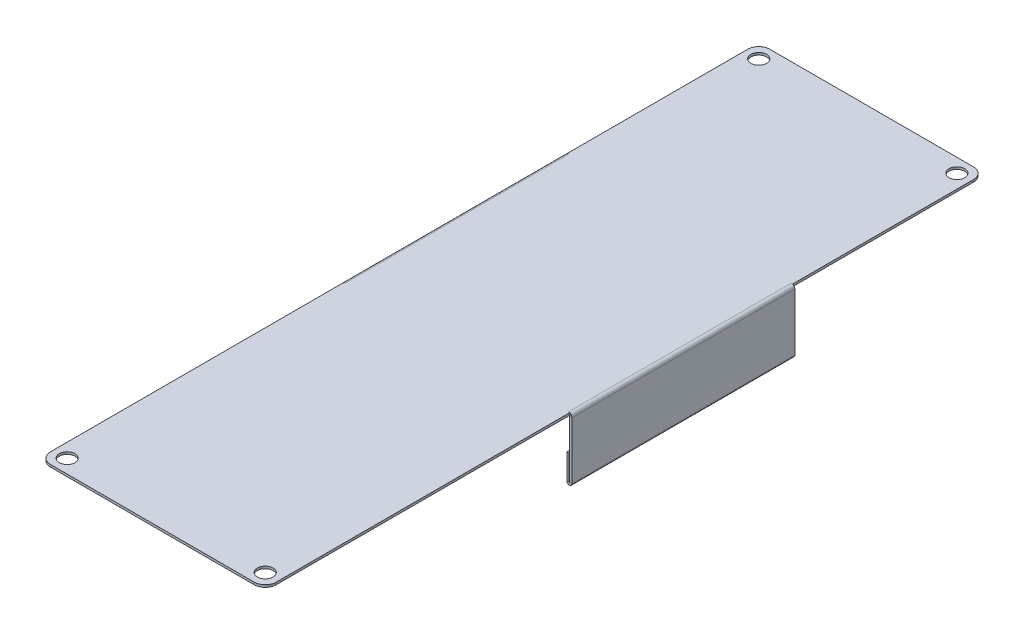
from build123d import *

# Parameters (mm, degrees)
BASE_FLANGE1_DEPTH           = 0.53
M3_CLEARANCE_HOLE1_D         = 3.6
EDGE_FLANGE1_STRIP_W         = 2.6915
EDGE_FLANGE1_STRIP_H         = 0.53
EDGE_FLANGE1_STRIP_CUT_DEPTH = 51.181
EDGE_FLANGE1_DEPTH           = 51.181
HEM1_START                   = -114.74296965
HEM1_DEPTH                   = 51.181
HEM1_2_DEPTH                 = 51.181


# Read off the part's stored shape, not the designer's step: Hem1
# Sheet-metal steps are written as plain solids
with BuildPart() as part:
    # Sketch1 → Base-Flange1 (new body)
    with BuildSketch(Plane(origin=(0, 33.434923007, 0), x_dir=(1, 0, 0), z_dir=(0, 1, 0))):
        with BuildLine():
            Line((1.778, -6.350000017), (25.146, -6.350000017))
            Line((25.146, -6.350000017), (25.146, 76.198203949))
            Line((25.146, 76.198203949), (-0.762, 76.198203949))
            Line((-0.762, 76.198203949), (-0.762, -3.810000017))
            ThreePointArc((-0.762, -3.810000017), (-0.018051224, -5.606051241), (1.778, -6.350000017))
        make_face()
    extrude(amount=BASE_FLANGE1_DEPTH)

    # M3 Clearance Hole1 (through all)
    with Locations(Plane(origin=(0, 33.964923007, 0), x_dir=(1, 0, 0), z_dir=(0, 1, 0))):
        with Locations((2.413, -3.176796068)):
            Hole(M3_CLEARANCE_HOLE1_D / 2)

    # Mirror1: part across plane


with BuildPart() as part_1:
    add(part.part)
    add(part.part.mirror(Plane(origin=(-0.762, 33.964923007, -76.198203949), x_dir=(1, 0, 0), z_dir=(0, 0, 1))))

    # Edge-Flange1 strip (across the edge) → Edge-Flange1 strip cut (cut)
    with BuildSketch(Plane(origin=(-0.6985, 33.434923007, -63.56196965), x_dir=(1, 0, 0), z_dir=(0, 0, -1))):
        with Locations((-1.09175, -0.265)):
            Rectangle(EDGE_FLANGE1_STRIP_W, EDGE_FLANGE1_STRIP_H)
    extrude(amount=EDGE_FLANGE1_STRIP_CUT_DEPTH, mode=Mode.SUBTRACT)

    # Edge-Flange1 section (across the edge) → Edge-Flange1 (add)
    with BuildSketch(Plane(origin=(-0.6985, 33.434923007, -63.56196965), x_dir=(1, 0, 0), z_dir=(0, 0, -1))):
        with BuildLine():
            Line((-0.53, 0.254), (-0.53, 13.97))
            Line((-0.53, 13.97), (0, 13.97))
            Line((0, 13.97), (0, 0.254))
            ThreePointArc((0, 0.254), (0.074394878, 0.074394878), (0.254, 0))
            Line((0.254, 0), (0.254, -0.53))
            ThreePointArc((0.254, -0.53), (-0.300371716, -0.300371716), (-0.53, 0.254))
        make_face()
    extrude(amount=EDGE_FLANGE1_DEPTH)

    # Hem1 outline → Hem1 (cut)
    with BuildSketch(Plane.XY.offset(HEM1_START)):
        with BuildLine():
            Line((-0.6985, 19.464923007), (-0.6985, 19.467082198))
            ThreePointArc((-0.6985, 19.467082198), (-1.075934205, 19.652877091), (-1.2285, 20.044923007))
            Line((-1.2285, 20.044923007), (-1.2285, 19.464923007))
            Line((-1.2285, 19.464923007), (-0.6985, 19.464923007))
        make_face()
    extrude(amount=HEM1_DEPTH, mode=Mode.SUBTRACT)

    # Hem1 2 outline → Hem1 2 (add)
    with BuildSketch(Plane.XY.offset(HEM1_START)):
        with BuildLine():
            Line((-0.0685, 25.814923007), (-0.5985, 25.814923007))
            Line((-0.5985, 25.814923007), (-0.5985, 20.044923007))
            ThreePointArc((-0.5985, 20.044923007), (-0.6485, 19.994923007), (-0.6985, 20.044923007))
            Line((-0.6985, 20.044923007), (-0.6985, 19.467082198))
            ThreePointArc((-0.6985, 19.467082198), (-0.256454084, 19.617488802), (-0.0685, 20.044923007))
            Line((-0.0685, 20.044923007), (-0.0685, 25.814923007))
        make_face()
    extrude(amount=HEM1_2_DEPTH)

    # Mirror2: part across face


with BuildPart() as part_2:
    add(part_1.part)
    add(part_1.part.mirror(Plane(origin=(25.146, 33.699923007, -76.198203949), x_dir=(0, 0, 1), z_dir=(1, 0, 0))))


solid = part_2.part
